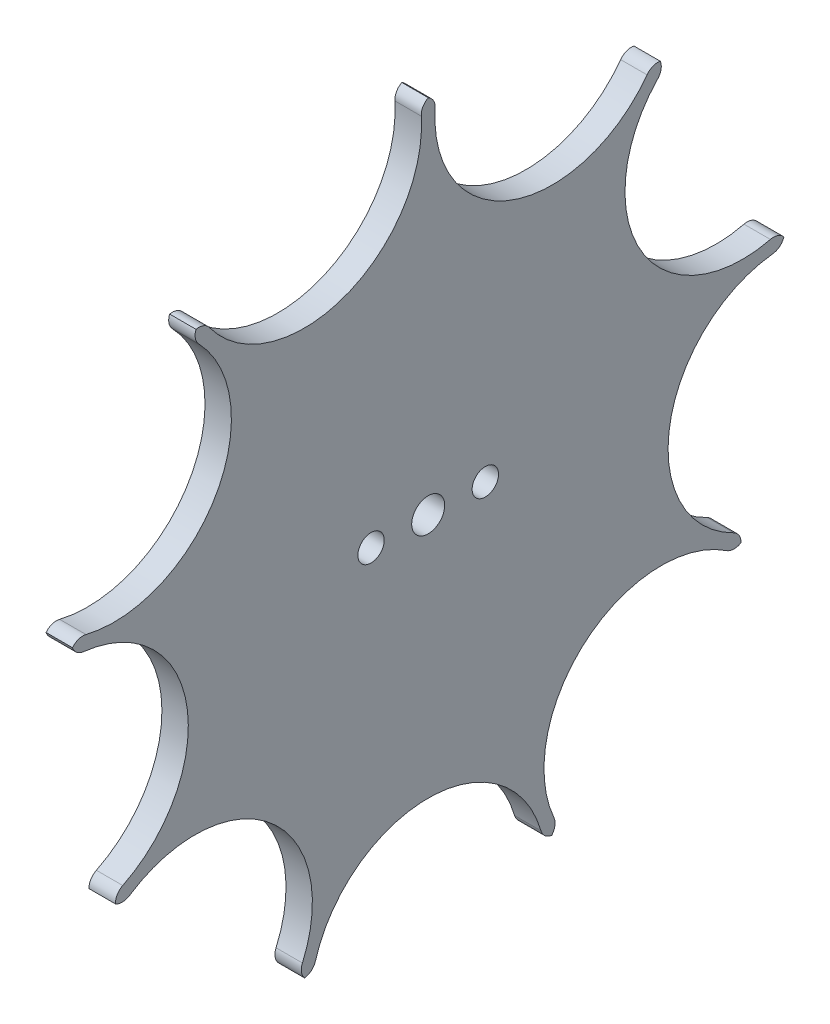
from build123d import *

# Parameters (mm, degrees)
SKETCH1_R           = 34.925
BOSS_EXTRUDE1_DEPTH = 1.27
SKETCH3_R           = 11.303
CUT_EXTRUDE1_DEPTH  = 6.35
CIRPATTERN1_COUNT   = 9
FILLET1_R           = 1.27
SKETCH5_R           = 1.5875
CUT_EXTRUDE2_DEPTH  = 6.35
SKETCH6_R           = 1.27
CUT_EXTRUDE3_DEPTH  = 49.864387552


with BuildPart() as part:
    # Sketch1 → Boss-Extrude1 (new, symmetric)
    with BuildSketch(Plane(origin=(0, 0, 0), x_dir=(0, 0, -1), z_dir=(1, 0, 0))):
        Circle(SKETCH1_R)
    extrude(amount=BOSS_EXTRUDE1_DEPTH, both=True)

    # Sketch3 → Cut-Extrude1 (cut, symmetric)
    with BuildSketch(Plane(origin=(0, 0, 0), x_dir=(0, 0, -1), z_dir=(1, 0, 0))):
        with Locations((0, -34.925)):
            Circle(SKETCH3_R)
    cut_extrude1 = extrude(amount=CUT_EXTRUDE1_DEPTH, both=True, mode=Mode.SUBTRACT)

    # CirPattern1: Cut-Extrude1 ×9 about axis
    cirpattern1_axis = Axis((0, 0, 0), (1, 0, 0))
    for i in range(1, CIRPATTERN1_COUNT):
        add(cut_extrude1.rotate(cirpattern1_axis, i * 360 / CIRPATTERN1_COUNT), mode=Mode.SUBTRACT)

    # Fillet1
    # the kernel refuses this fillet: 1.27 mm, written as the material it takes off along each edge
    with BuildSketch(Plane(origin=(-4.923134512, -16.731633019, -30.656289429), x_dir=(0, 0.38689872135285164, 0.9221222150103143), z_dir=(1, 0, 0)), Plane(origin=(-4.923134512, 27.285133925, -21.800850711), x_dir=(0, -0.8409288486623601, 0.541145702641532), z_dir=(1, 0, 0)), Plane(origin=(-4.923134512, 34.91494194, 0.838125473), x_dir=(0, -0.9920306242693342, -0.12599698612187168), z_dir=(1, 0, 0)), Plane(origin=(-4.923134512, 26.207660586, 23.084933434), x_dir=(0, -0.6789502455883892, -0.7341842847783286), z_dir=(1, 0, 0)), Plane(origin=(-4.923134512, 5.237523577, 34.53004448), x_dir=(0, -0.048181501305167504, -0.9988385970375695), z_dir=(1, 0, 0)), Plane(origin=(-4.923134512, -18.183308922, 29.818163955), x_dir=(0, 0.6051319029164822, -0.7961252288884437), z_dir=(1, 0, 0)), Plane(origin=(-4.923134512, -33.095969091, 11.154033124), x_dir=(0, 0.9752973644715361, -0.22089601819606364), z_dir=(1, 0, 0)), Plane(origin=(-4.923134512, -32.522657502, -12.729193769), x_dir=(0, 0.8891103499675269, 0.45769289439603716), z_dir=(1, 0, 0))) as fillet1_piece_1:
        with BuildLine():
            CenterArc((1.436473101, 1.267699411), FILLET1_R, 171.739357487, 94.811422393)
            ThreePointArc((0.179649711, 1.450168495), (0.082239687, 0.726023913), (0, 0))
            ThreePointArc((0, 0), (0.680032479, 0.020475246), (1.360064958, 0))
        make_face()
    extrude(amount=9.846269024, mode=Mode.SUBTRACT)
    with BuildSketch(Plane(origin=(-4.923134512, 5.237523577, -34.53004448), x_dir=(0, 0.9853377060596639, 0.1706153715732537), z_dir=(1, 0, 0)), Plane(origin=(-4.923134512, 34.91494194, -0.838125473), x_dir=(0, 0.0030787563353731583, 0.999995260618483), z_dir=(1, 0, 0)), Plane(origin=(-4.923134512, 27.285133925, 21.800850711), x_dir=(0, -0.6404260990883884, 0.7680197989677282), z_dir=(1, 0, 0)), Plane(origin=(-4.923134512, 6.888308505, 34.238966558), x_dir=(0, -0.984268465205427, 0.17667933779067993), z_dir=(1, 0, 0)), Plane(origin=(-4.923134512, -16.731633019, 30.656289429), x_dir=(0, -0.8675606775273359, -0.497331349110741), z_dir=(1, 0, 0)), Plane(origin=(-4.923134512, -32.522657502, 12.729193769), x_dir=(0, -0.34491160697127204, -0.9386351705409801), z_dir=(1, 0, 0)), Plane(origin=(-4.923134512, -18.183308922, -29.818163955), x_dir=(0, 0.8644819211919598, -0.5026639115077373), z_dir=(1, 0, 0))) as fillet1_piece_2:
        with BuildLine():
            CenterArc((1.434685554, 1.269722067), FILLET1_R, 176.387286037, 94.811422393)
            ThreePointArc((0.167209335, 1.349747283), (0.103924585, 0.67235637), (0, 0))
            ThreePointArc((0, 0), (0.730626902, -0.007643151), (1.461253805, 0))
        make_face()
    extrude(amount=9.846269024, mode=Mode.SUBTRACT)
    with BuildSketch(Plane(origin=(-4.923134512, 6.888308505, -34.238966558), x_dir=(0, -0.984268465205427, -0.1766793377906796), z_dir=(1, 0, 0))) as fillet1_piece_3:
        with BuildLine():
            CenterArc((1.434685554, -1.269722067), FILLET1_R, 88.80129157, 94.811422393)
            ThreePointArc((0.167209335, -1.349747283), (0.103924585, -0.67235637), (0, 0))
            ThreePointArc((0, 0), (0.730626902, 0.007643151), (1.461253805, 0))
        make_face()
    extrude(amount=9.846269024, mode=Mode.SUBTRACT)
    with BuildSketch(Plane(origin=(-4.923134512, 26.207660586, -23.084933434), x_dir=(0, -0.6789502455883865, 0.7341842847783312), z_dir=(1, 0, 0)), Plane(origin=(-4.923134512, -33.095969091, -11.154033124), x_dir=(0, 0.9752973644715363, 0.22089601819606305), z_dir=(1, 0, 0))) as fillet1_piece_4:
        with BuildLine():
            CenterArc((1.436473101, -1.267699411), FILLET1_R, 93.44922012, 94.811422393)
            ThreePointArc((0.179649711, -1.450168495), (0.082239687, -0.726023913), (0, 0))
            ThreePointArc((0, 0), (0.680032479, -0.020475246), (1.360064958, 0))
        make_face()
    extrude(amount=9.846269024, mode=Mode.SUBTRACT)

    # Sketch5 → Cut-Extrude2 (cut, symmetric)
    with BuildSketch(Plane(origin=(0, 0, 0), x_dir=(0, 0, -1), z_dir=(1, 0, 0))):
        Circle(SKETCH5_R)
    extrude(amount=CUT_EXTRUDE2_DEPTH, both=True, mode=Mode.SUBTRACT)

    # Sketch6 → Cut-Extrude3 (cut, through all)
    with BuildSketch(Plane(origin=(1.27, 0, 0), x_dir=(0, 0, -1), z_dir=(1, 0, 0))):
        with Locations((-5.5, 0)):
            Circle(SKETCH6_R)
        with Locations((5.5, 0)):
            Circle(SKETCH6_R)
    extrude(amount=-CUT_EXTRUDE3_DEPTH, mode=Mode.SUBTRACT)


solid = part.part
